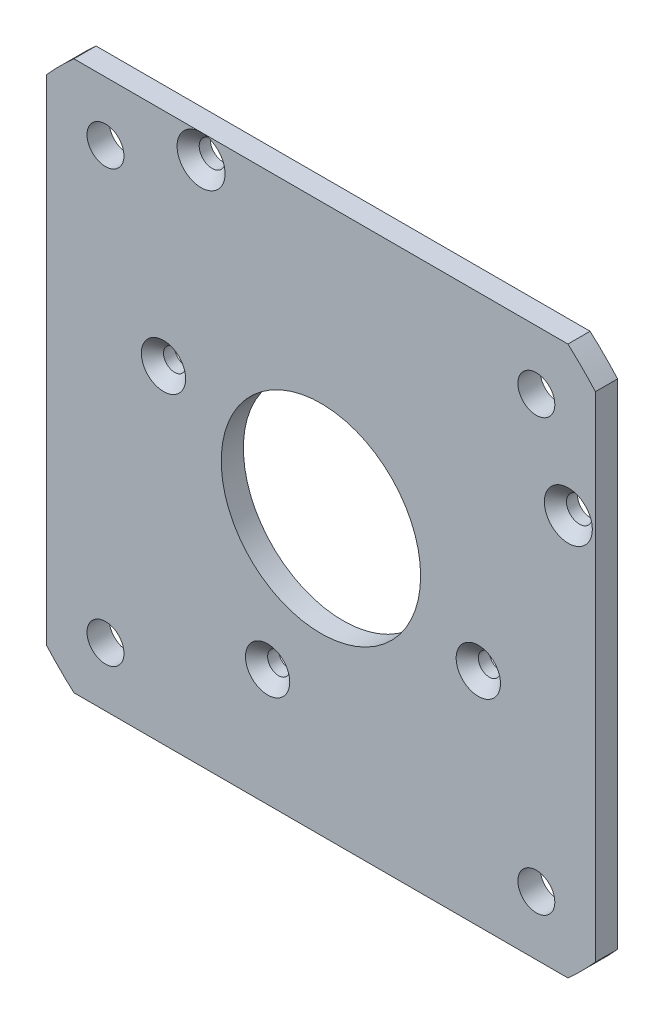
from build123d import *

# Parameters (mm, degrees)
SKETCH_1_R             = 5
SKETCH_1_R_2           = 27
SM_BASE_FLANGE_1_DEPTH = 6
SKETCH_6_R             = 3.5
SKETCH_6_R_2           = 3
CUT_EXTRUDE_1_DEPTH    = 106.298498587
CHAMFER_1_SIZE         = 3


# Sheet-metal steps are written as plain solids
with BuildPart() as part:
    # Sketch 1 → Базовая кромка1 (new body)
    with BuildSketch(Plane.XY):
        with BuildLine():
            Line((74.336309448, -66.888811454), (74.336309448, 66.888811454))
            ThreePointArc((74.336309448, 66.888811454), (70.710678119, 70.710678119), (66.888811454, 74.336309448))
            Line((66.888811454, 74.336309448), (-66.888811454, 74.336309448))
            ThreePointArc((-66.888811454, 74.336309448), (-70.710678119, 70.710678119), (-74.336309448, 66.888811454))
            Line((-74.336309448, 66.888811454), (-74.336309448, -66.888811454))
            ThreePointArc((-74.336309448, -66.888811454), (-70.710678119, -70.710678119), (-66.888811454, -74.336309448))
            Line((-66.888811454, -74.336309448), (66.888811454, -74.336309448))
            ThreePointArc((66.888811454, -74.336309448), (70.710678119, -70.710678119), (74.336309448, -66.888811454))
        make_face()
        with Locations((-58.336309448, -58.336309448)):
            Circle(SKETCH_1_R, mode=Mode.SUBTRACT)
        with Locations((-58.336309448, 58.336309448)):
            Circle(SKETCH_1_R, mode=Mode.SUBTRACT)
        with Locations((58.336309448, 58.336309448)):
            Circle(SKETCH_1_R, mode=Mode.SUBTRACT)
        with Locations((58.336309448, -58.336309448)):
            Circle(SKETCH_1_R, mode=Mode.SUBTRACT)
        Circle(SKETCH_1_R_2, mode=Mode.SUBTRACT)
    extrude(amount=-SM_BASE_FLANGE_1_DEPTH)

    # Эскиз6 → Вырез-Вытянуть1 (cut, through all)
    with BuildSketch(Plane.XY):
        with Locations((-32.454521271, 67.836309448)):
            Circle(SKETCH_6_R)
        with Locations((-42.621905135, 14.435137777)):
            Circle(SKETCH_6_R_2)
        with Locations((-14.435137777, -42.621905135)):
            Circle(SKETCH_6_R_2)
        with Locations((42.621905135, -14.435137777)):
            Circle(SKETCH_6_R_2)
        with Locations((66.996590711, 34.154321301)):
            Circle(SKETCH_6_R)
    extrude(amount=-CUT_EXTRUDE_1_DEPTH, mode=Mode.SUBTRACT)

    # Фаска1
    chamfer_1_edges = [part.edges().sort_by_distance(p)[0] for p in [
        (-35.954521271, 67.836309448, 0),
        (-45.621905135, 14.435137777, 0),
        (-17.435137777, -42.621905135, 0),
        (39.621905135, -14.435137777, 0),
        (63.496590711, 34.154321301, 0),
    ]]
    chamfer(chamfer_1_edges, length=CHAMFER_1_SIZE - 0.0001)  # a hair under: the kernel refuses the full size


solid = part.part
